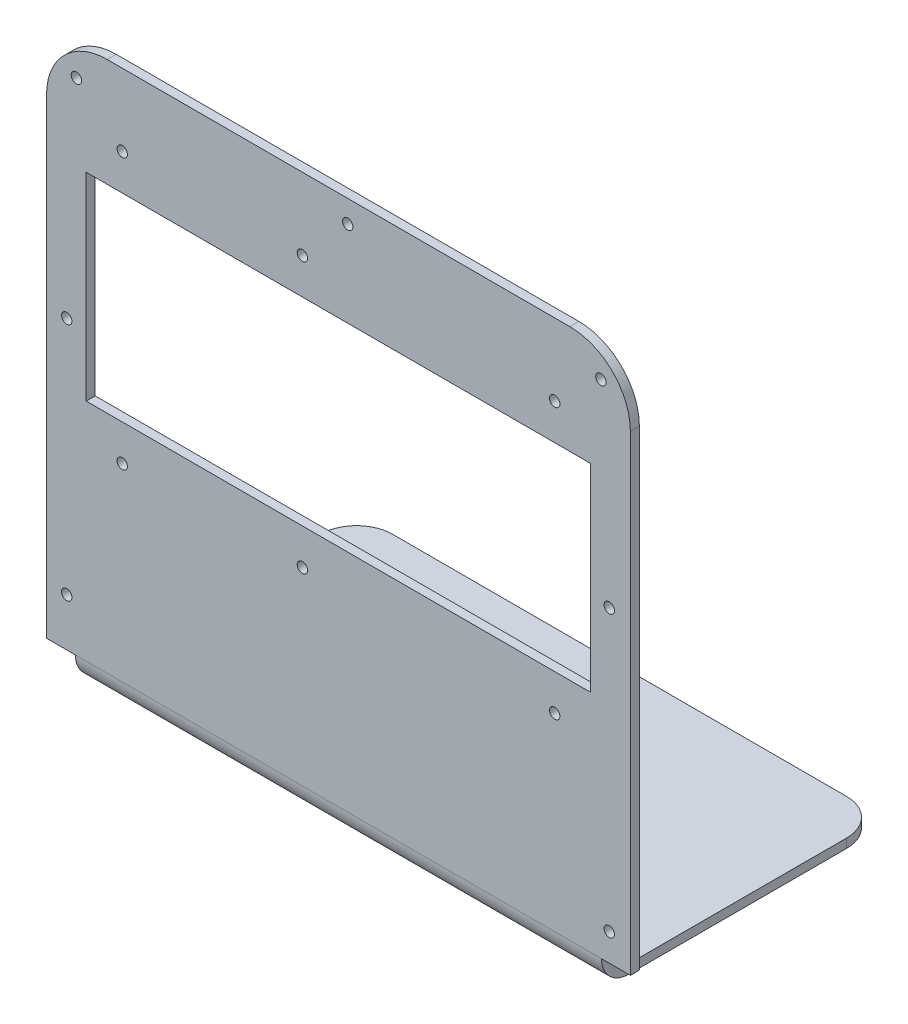
from build123d import *

# Parameters (mm, degrees)
BASE_FLANGE1_DEPTH          = 102.87
SKETCH6_W                   = 9.525
SKETCH6_H                   = 99.06
CUT_EXTRUDE1_DEPTH          = 10.16
FILLET1_R                   = 21.336
FILLET2_R                   = 12.7
SKETCH8_W                   = 177.8
SKETCH8_H                   = 69.85
CUT_EXTRUDE2_DEPTH          = 10.16
F_27_0_144_DIAMETER_HOLE1_D = 3.6576
F_27_0_144_DIAMETER_HOLE2_D = 3.6576


# Sheet-metal steps are written as plain solids
with BuildPart() as part:
    # Sketch1 → Base-Flange1 (new, symmetric)
    with BuildSketch(Plane.YZ):
        with BuildLine():
            Line((-25.4, -73.66), (-25.4, 15.875))
            ThreePointArc((-25.4, 15.875), (-22.610192091, 22.610192091), (-15.875, 25.4))
            Line((-15.875, 25.4), (171.45, 25.4))
            Line((171.45, 25.4), (171.45, 22.225))
            Line((171.45, 22.225), (-15.875, 22.225))
            ThreePointArc((-15.875, 22.225), (-20.365128061, 20.365128061), (-22.225, 15.875))
            Line((-22.225, 15.875), (-22.225, -73.66))
            Line((-22.225, -73.66), (-25.4, -73.66))
        make_face()
    extrude(amount=BASE_FLANGE1_DEPTH, both=True)

    # Sketch6 → Cut-Extrude1 (cut)
    with BuildSketch(Plane.YZ.offset(102.87)):
        with Locations((-20.6375, -24.13)):
            Rectangle(SKETCH6_W, SKETCH6_H)
    cut_extrude1 = extrude(amount=-CUT_EXTRUDE1_DEPTH, mode=Mode.SUBTRACT)

    # Mirror1: Cut-Extrude1 across plane
    add(cut_extrude1.mirror(Plane(origin=(0, 0, 0), x_dir=(0, 0, 1), z_dir=(1, 0, 0))), mode=Mode.SUBTRACT)

    # Fillet1
    fillet1_edges = [part.edges().sort_by_distance(p)[0] for p in [
        (102.87, 171.45, 23.8125),
        (-102.87, 171.45, 23.8125),
    ]]
    fillet(fillet1_edges, radius=FILLET1_R)

    # Fillet2
    fillet2_edges = [part.edges().sort_by_distance(p)[0] for p in [
        (92.71, -23.8125, -73.66),
        (-92.71, -23.8125, -73.66),
    ]]
    fillet(fillet2_edges, radius=FILLET2_R)

    # Sketch8 → Cut-Extrude2 (cut)
    with BuildSketch(Plane.XY.offset(25.4)):
        with Locations((0, 98.425)):
            Rectangle(SKETCH8_W, SKETCH8_H)
    extrude(amount=-CUT_EXTRUDE2_DEPTH, mode=Mode.SUBTRACT)

    # #27 (0.144) Diameter Hole1 (through all)
    with Locations(Plane.XY.offset(25.4)):
        with Locations((-76.2, 146.05), (-12.7, 146.05), (76.2, 146.05), (76.2, 50.8), (-12.7, 50.8), (-76.2, 50.8)):
            Hole(F_27_0_144_DIAMETER_HOLE1_D / 2)

    # #27 (0.144) Diameter Hole2 (through all)
    with Locations(Plane.XY.offset(25.4)):
        with Locations((92.4814, 160.8074), (95.4278, 92.583), (95.4278, -6.223), (-95.758, 1.016), (-95.758, 85.344), (-92.3544, 160.401), (3.2512, 163.6268)):
            Hole(F_27_0_144_DIAMETER_HOLE2_D / 2)


solid = part.part
